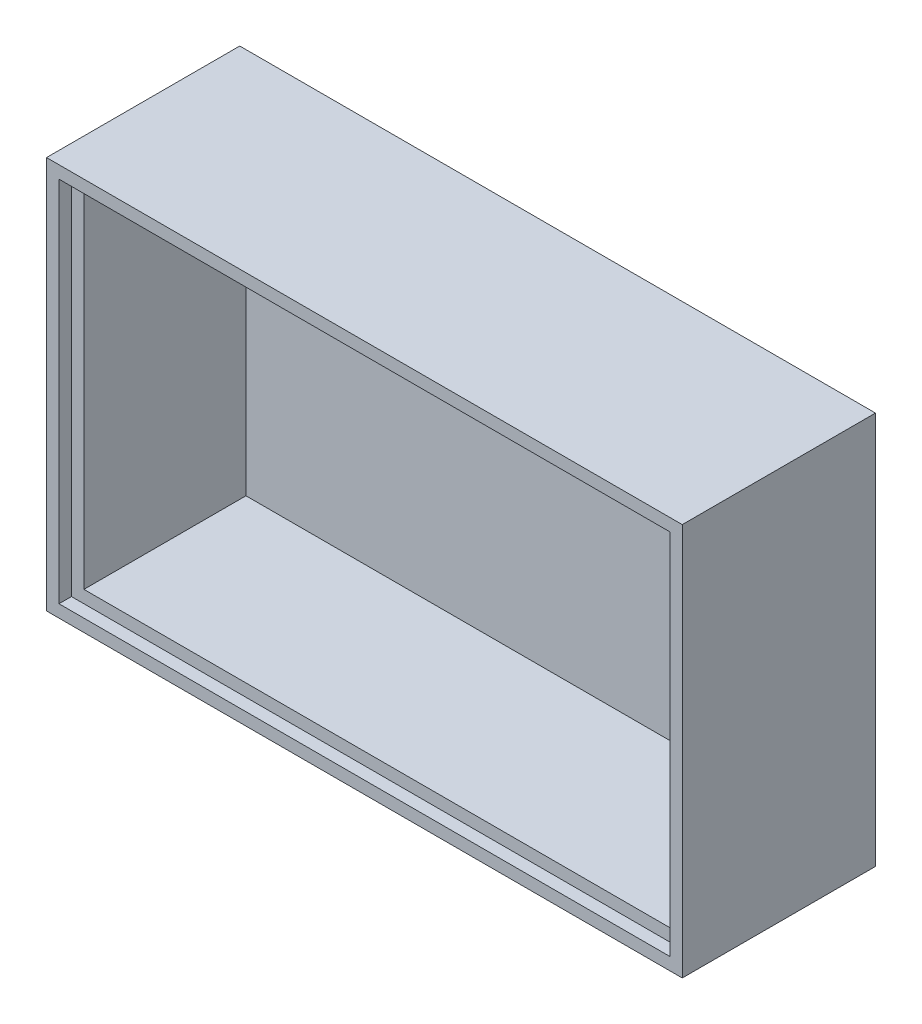
from build123d import *

# Parameters (mm, degrees)
SKICA1_W                = 102
SKICA1_H                = 63
P_IDAT_VYSUNUT_M1_DEPTH = 3
SKICA1_4_W              = 102
SKICA1_4_H              = 63
SKICA1_4_W_2            = 98
SKICA1_4_H_2            = 59
P_IDAT_VYSUNUT_M2_DEPTH = 31
SKICA1_5_W              = 98
SKICA1_5_H              = 59
SKICA1_5_W_2            = 94
SKICA1_5_H_2            = 55
P_IDAT_VYSUNUT_M3_DEPTH = 29


with BuildPart() as part:
    # Skica1 → Přidat vysunutím1 (new body)
    with BuildSketch(Plane.XY):
        with Locations((49, 29.5)):
            Rectangle(SKICA1_W, SKICA1_H)
    extrude(amount=P_IDAT_VYSUNUT_M1_DEPTH)

    # Skica1<4> → Přidat vysunutím2 (add)
    with BuildSketch(Plane.XY):
        with Locations((49, 29.5)):
            Rectangle(SKICA1_4_W, SKICA1_4_H)
        with Locations((49, 29.5)):
            Rectangle(SKICA1_4_W_2, SKICA1_4_H_2, mode=Mode.SUBTRACT)
    extrude(amount=P_IDAT_VYSUNUT_M2_DEPTH)

    # Skica1<5> → Přidat vysunutím3 (add)
    with BuildSketch(Plane.XY):
        with Locations((49, 29.5)):
            Rectangle(SKICA1_5_W, SKICA1_5_H)
        with Locations((49, 29.5)):
            Rectangle(SKICA1_5_W_2, SKICA1_5_H_2, mode=Mode.SUBTRACT)
    extrude(amount=P_IDAT_VYSUNUT_M3_DEPTH)


solid = part.part
